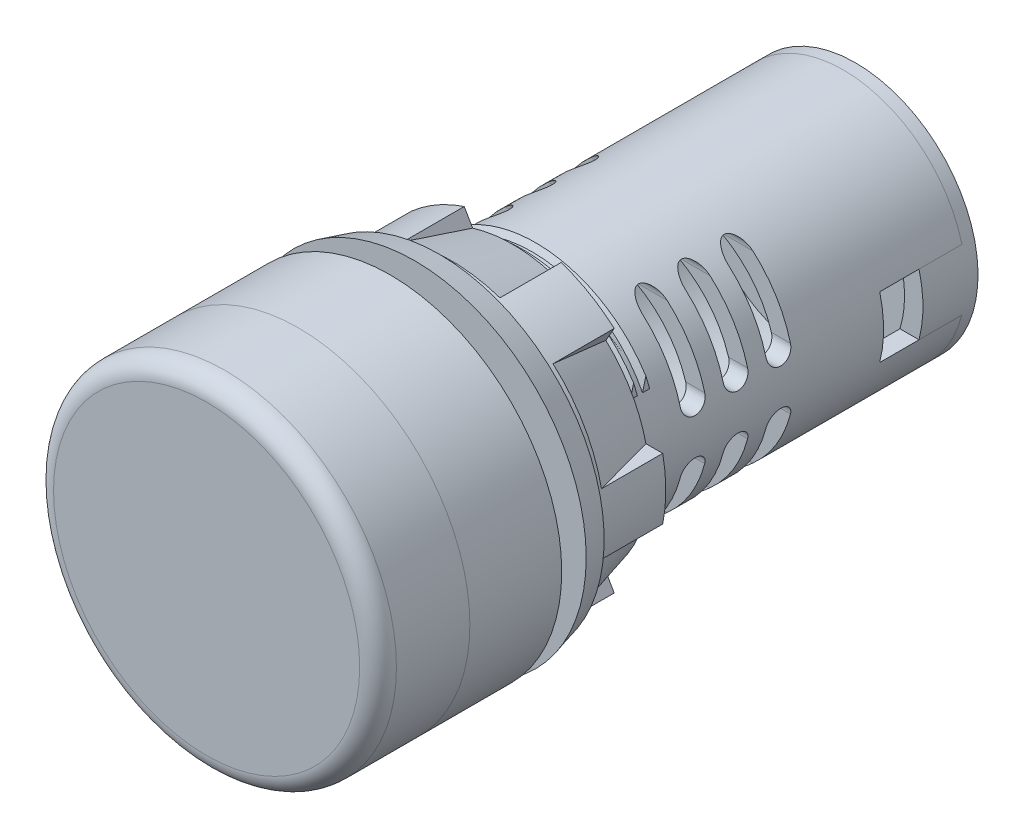
from build123d import *
from build123d.topology import SkipClean

# Parameters (mm, degrees)
VACIADO1_T                 = -1.5
CORTAR_EXTRUIR1_DEPTH      = 49.70574914730293
CORTAR_EXTRUIR1_DEPTH_BACK = 49.70574914730293
CROQUIS14_R                = 10.000000000000005
CROQUIS14_R_2              = 2.4999999999999947
CROQUIS14_R_3              = 2.499999999999994
SALIENTE_EXTRUIR3_DEPTH    = 1
SALIENTE_EXTRUIR4_DEPTH    = 3.5
SALIENTE_EXTRUIR1_START    = 2.5
SALIENTE_EXTRUIR1_DEPTH    = 2.5
BARRER1_PITCH              = 0.9999999999999974
CORTAR_EXTRUIR3_DEPTH      = 43.848570636603505
CROQUIS11_R                = 14.000000000000005
SALIENTE_EXTRUIR2_DEPTH    = 7.5
VACIADO5_T                 = -1.5
REDONDEO1_R                = 1.5
CROQUIS15_R                = 14.000000000000007
CROQUIS15_R_2              = 10.000000000000007
SALIENTE_EXTRUIR6_DEPTH    = 2
SALIENTE_EXTRUIR7_START    = 6
CROQUIS16_R                = 12.500000000000009
CROQUIS16_R_2              = 10.000000000000007
SALIENTE_EXTRUIR7_DEPTH    = 6
CHAFL_N1_SIZE              = 2
CHAFL_N1_SIZE_2            = 0.535898385
CHAFL_N2_SIZE              = 5
CHAFL_N2_SIZE2             = 1.339745962155617
SALIENTE_EXTRUIR9_START    = 6
SALIENTE_EXTRUIR9_DEPTH    = 6


with BuildPart() as part:
    # Croquis1 → Revolución1 (revolve)
    with BuildSketch(Plane(origin=(0, 0, 0), x_dir=(0, 0, -1), z_dir=(1, 0, 0))):
        Polygon((7.499999999999993, 9.999999999999998), (44.49999999999999, 9.999999999999998), (44.49999999999999, -2.56e-15), (7.499999999999995, -5.2e-15), (0, 0), (-6.94e-15, 14), (7.499999999999993, 14), align=None)
    revolve(axis=Axis((0, -2.56e-15, -44.49999999999999), (0, -7e-17, 1)))

    # Vaciado1
    vaciado1_openings = [part.faces().sort_by_distance(p)[0] for p in [
        (0, 0, 0),
    ]]
    offset(amount=VACIADO1_T, openings=vaciado1_openings, kind=Kind.INTERSECTION)

    # Croquis2 → Cortar-Extruir1 (cut, two sides: drawn at the far end of the back side and taken through both)
    with BuildSketch(Plane(origin=(0, 0, 0), x_dir=(0, 0, -1), z_dir=(1, 0, 0)).offset(-CORTAR_EXTRUIR1_DEPTH_BACK)):
        with BuildLine():
            Line((26.999999999999986, 7.499999999999998), (26.999999999999986, 2.499999999999998))
            ThreePointArc((26.999999999999986, 2.499999999999998), (25.999999999999993, 1.5000000000000013), (24.999999999999996, 2.4999999999999973))
            Line((24.999999999999996, 2.4999999999999973), (24.999999999999996, 7.499999999999998))
            ThreePointArc((24.999999999999996, 7.499999999999998), (25.999999999999993, 8.49999999999999), (26.999999999999986, 7.499999999999998))
        make_face()
        with BuildLine():
            Line((30.499999999999986, 7.499999999999998), (30.499999999999986, 2.499999999999998))
            ThreePointArc((30.499999999999986, 2.499999999999998), (29.499999999999993, 1.5000000000000013), (28.499999999999996, 2.4999999999999973))
            Line((28.499999999999996, 2.4999999999999973), (28.499999999999996, 7.499999999999998))
            ThreePointArc((28.499999999999996, 7.499999999999998), (29.499999999999993, 8.49999999999999), (30.499999999999986, 7.499999999999998))
        make_face()
        with BuildLine():
            Line((30.50000000000009, -2.500000000000002), (30.50000000000009, -7.500000000000003))
            ThreePointArc((30.50000000000009, -7.500000000000003), (29.500000000000096, -8.499999999999996), (28.500000000000103, -7.5000000000000036))
            Line((28.500000000000103, -7.5000000000000036), (28.500000000000103, -2.500000000000002))
            ThreePointArc((28.500000000000103, -2.500000000000002), (29.500000000000096, -1.5000000000000102), (30.50000000000009, -2.500000000000002))
        make_face()
        Polygon((44.5, 2.499999999999998), (37.787323049539765, 2.499999999999997), (37.787323049539765, -2.500000000000002), (44.49999999999999, -2.500000000000002), align=None)
        with BuildLine():
            Line((23.499999999999986, 7.499999999999973), (23.499999999999986, 2.499999999999974))
            ThreePointArc((23.499999999999986, 2.499999999999974), (22.499999999999993, 1.499999999999981), (21.5, 2.4999999999999734))
            Line((21.5, 2.4999999999999734), (21.5, 7.499999999999973))
            ThreePointArc((21.5, 7.499999999999973), (22.499999999999993, 8.499999999999964), (23.499999999999986, 7.499999999999973))
        make_face()
        with BuildLine():
            Line((23.50000000000009, -2.5000000000000266), (23.50000000000009, -7.500000000000027))
            ThreePointArc((23.50000000000009, -7.500000000000027), (22.500000000000096, -8.50000000000002), (21.500000000000103, -7.5000000000000275))
            Line((21.500000000000103, -7.5000000000000275), (21.500000000000103, -2.5000000000000266))
            ThreePointArc((21.500000000000103, -2.5000000000000266), (22.500000000000096, -1.5000000000000346), (23.50000000000009, -2.5000000000000266))
        make_face()
        with BuildLine():
            Line((27.00000000000009, -2.500000000000002), (27.00000000000009, -7.500000000000003))
            ThreePointArc((27.00000000000009, -7.500000000000003), (26.000000000000096, -8.499999999999996), (25.000000000000103, -7.5000000000000036))
            Line((25.000000000000103, -7.5000000000000036), (25.000000000000103, -2.500000000000002))
            ThreePointArc((25.000000000000103, -2.500000000000002), (26.000000000000096, -1.5000000000000102), (27.00000000000009, -2.500000000000002))
        make_face()
    extrude(amount=CORTAR_EXTRUIR1_DEPTH + CORTAR_EXTRUIR1_DEPTH_BACK, mode=Mode.SUBTRACT)

    # Croquis4 → Saliente-Extruir1 (add)
    with BuildSketch(Plane(origin=(0, 2.96e-15, -41.499999999999986), x_dir=(-1, 0, 0), z_dir=(0, 7e-17, -1)).offset(SALIENTE_EXTRUIR1_START)):
        with BuildLine():
            ThreePointArc((8.124038404635963, -2.5000000000000053), (8.500000000000002, -5.74e-15), (8.124038404635963, 2.4999999999999947))
            ThreePointArc((8.124038404635963, 2.4999999999999947), (5.2e-16, 8.499999999999996), (-8.124038404635963, 2.4999999999999947))
            ThreePointArc((-8.124038404635963, 2.4999999999999947), (-8.500000000000002, -4.7e-15), (-8.124038404635963, -2.500000000000005))
            ThreePointArc((-8.124038404635963, -2.500000000000005), (5.2e-16, -8.500000000000007), (8.124038404635963, -2.5000000000000053))
        make_face()
    extrude(amount=-SALIENTE_EXTRUIR1_DEPTH)

    # Barrer1: arcs per turn and ends read off the stored shape
    # Barrer1: the profile of Croquis9 profile screwed along a right-hand helix through 12 turns, 8 arcs to a turn; built about Z, then put on its axis
    barrer1_z = Axis((0, 0, 0), (0, 0, 1))
    barrer1_corners = [(9.9997, 0, -0.250173205), (10.5, 0, 0.038675135), (9.9997, 0, 0.327523474)]
    with BuildLine(mode=Mode.PRIVATE) as barrer1_profile:
        Line(barrer1_corners[0], barrer1_corners[1])
        Line(barrer1_corners[1], barrer1_corners[2])
        Line(barrer1_corners[2], barrer1_corners[0])
    barrer1_cap = Face(barrer1_profile.wire())
    barrer1_turn_angles = [0, 22.5, 45, 67.5, 90, 112.5, 135, 157.5, 180, 202.5, 225, 247.5, 270, 292.5, 315, 337.5, 360]
    barrer1_turn_weights = [1, 0.9238795325112867, 1, 0.9238795325112867, 1, 0.9238795325112867, 1, 0.9238795325112867, 1, 0.9238795325112867, 1, 0.9238795325112867, 1, 0.9238795325112867, 1, 0.9238795325112867, 1]
    barrer1_turn_rails = [Edge.make_bspline([Vector(p[0], p[1], 0).rotate(barrer1_z, barrer1_turn_angles[k]) / barrer1_turn_weights[k] + Vector(0, 0, p[2] + BARRER1_PITCH * barrer1_turn_angles[k] / 360) for k in range(17)], [0, 0, 0, 1, 1, 2, 2, 3, 3, 4, 4, 5, 5, 6, 6, 7, 7, 8, 8, 8], 2, barrer1_turn_weights) for p in barrer1_corners]
    barrer1_turn_sides = [Face.make_surface_from_curves(barrer1_turn_rails[p[0]], barrer1_turn_rails[p[1]]) for p in [(0, 1), (1, 2), (2, 0)]]
    barrer1 = Plane(origin=(0, -4.35e-15, -19.499999999999993), x_dir=(1, -3.49e-15, 0), z_dir=(0, -7e-17, 1)) * Solid(Shell([*[p.moved(Location((0, 0, BARRER1_PITCH * i))) for i in range(12) for p in barrer1_turn_sides], barrer1_cap, barrer1_cap.rotate(barrer1_z, 4320).moved(Location((0, 0, BARRER1_PITCH * 4320 / 360)))]))
    add(barrer1)

    # Croquis10 → Cortar-Extruir3 (cut, through all)
    with BuildSketch(Plane(origin=(0, 5.4e-16, -7.499999999999994), x_dir=(-1, 0, 0), z_dir=(0, 7e-17, -1))):
        with BuildLine():
            Line((-8.999999999999998, -6), (-8.999999999999998, -4.358898943540685))
            ThreePointArc((-8.999999999999998, -4.358898943540685), (-10, -4.52e-15), (-8.999999999999998, 4.358898943540672))
            Line((-8.999999999999998, 4.358898943540672), (-8.999999999999998, 6))
            Line((-8.999999999999998, 6), (-10.999999999999998, 6))
            Line((-10.999999999999998, 6), (-10.999999999999998, -6))
            Line((-10.999999999999998, -6), (-8.999999999999998, -6))
        make_face()
        with BuildLine():
            Line((8.999999999999998, 6), (10.999999999999998, 6))
            Line((10.999999999999998, 6), (10.999999999999998, -6))
            Line((10.999999999999998, -6), (8.999999999999998, -6))
            Line((8.999999999999998, -6), (8.999999999999998, -4.358898943540685))
            ThreePointArc((8.999999999999998, -4.358898943540685), (10, -6.29e-15), (8.999999999999998, 4.358898943540672))
            Line((8.999999999999998, 4.358898943540672), (8.999999999999998, 6))
        make_face()
    extrude(amount=CORTAR_EXTRUIR3_DEPTH, mode=Mode.SUBTRACT)


with BuildPart() as body_2:
    # Croquis14 → Saliente-Extruir3 (new body)
    # profile 1 of 3: a face of its own
    with BuildSketch(Plane(origin=(0, 3.18e-15, -44.49999999999999), x_dir=(-1, 0, 0), z_dir=(0, 7e-17, -1))):
        Circle(CROQUIS14_R)
        with Locations((-5, 5.2e-16)):
            Circle(CROQUIS14_R_2, mode=Mode.SUBTRACT)
        with Locations((5, 2.3e-16)):
            Circle(CROQUIS14_R_3, mode=Mode.SUBTRACT)
    # profile 2 of 3: a face of its own
    with BuildSketch(Plane(origin=(0, 3.18e-15, -44.49999999999999), x_dir=(-1, 0, 0), z_dir=(0, 7e-17, -1))):
        with BuildLine():
            Line((9.682458365518544, 2.4999999999999942), (8.124038404635963, 2.4999999999999942))
            ThreePointArc((8.124038404635963, 2.4999999999999942), (8.500000000000002, -5.27e-15), (8.124038404635963, -2.500000000000005))
            Line((8.124038404635963, -2.500000000000005), (9.682458365518546, -2.500000000000005))
            ThreePointArc((9.682458365518546, -2.500000000000005), (10.000000000000004, -5.18e-15), (9.682458365518544, 2.4999999999999942))
        make_face()
    # profile 3 of 3: a face of its own
    with BuildSketch(Plane(origin=(0, 3.18e-15, -44.49999999999999), x_dir=(-1, 0, 0), z_dir=(0, 7e-17, -1))):
        with BuildLine():
            Line((-9.682458365518546, -2.500000000000005), (-8.124038404635963, -2.500000000000005))
            ThreePointArc((-8.124038404635963, -2.500000000000005), (-8.500000000000004, -4.7e-15), (-8.124038404635964, 2.4999999999999942))
            Line((-8.124038404635964, 2.4999999999999942), (-9.682458365518544, 2.4999999999999942))
            ThreePointArc((-9.682458365518544, 2.4999999999999942), (-10.000000000000002, -4.52e-15), (-9.682458365518546, -2.500000000000005))
        make_face()
    extrude(amount=SALIENTE_EXTRUIR3_DEPTH)

    # Croquis14<4> → Saliente-Extruir4 (add)
    with SkipClean():  # the faces are left unmerged after this step: merging them gives an invalid solid
        with BuildSketch(Plane(origin=(0, 3.18e-15, -44.49999999999999), x_dir=(-1, 0, 0), z_dir=(0, 7e-17, -1))):
            with BuildLine():
                Line((-8.124038404635964, 2.4999999999999942), (-9.682458365518544, 2.4999999999999942))
                ThreePointArc((-9.682458365518547, 2.4999999999999982), (-10.000000000000005, -4.52e-15), (-9.68245836551855, -2.500000000000003))
                Line((-9.682458365518546, -2.500000000000005), (-8.124038404635963, -2.500000000000005))
                ThreePointArc((-8.124038404635964, -2.500000000000006), (-8.500000000000004, -6e-15), (-8.124038404635964, 2.499999999999994))
            make_face()
            with BuildLine():
                ThreePointArc((10.000000000000005, -5.74e-15), (9.920296962671673, 1.260042924827276), (9.682458365518547, 2.4999999999999956))
                Line((9.682458365518544, 2.4999999999999942), (8.124038404635963, 2.4999999999999942))
                ThreePointArc((8.124038404635964, 2.4999999999999947), (8.500000000000004, -5.66e-15), (8.124038404635964, -2.5000000000000053))
                Line((8.124038404635963, -2.500000000000005), (9.682458365518546, -2.500000000000005))
                ThreePointArc((9.682458365518547, -2.500000000000011), (9.920296962671673, -1.2600429248272864), (10.000000000000005, -8.19e-15))
            make_face()
        extrude(amount=-SALIENTE_EXTRUIR4_DEPTH)


with BuildPart() as body_3:
    # Croquis11 → Saliente-Extruir2 (new body)
    with BuildSketch(Plane.XY):
        Circle(CROQUIS11_R)
    extrude(amount=SALIENTE_EXTRUIR2_DEPTH)

    # Vaciado5
    vaciado5_openings = [body_3.faces().sort_by_distance(p)[0] for p in [
        (0, 0, 0),
    ]]
    offset(amount=VACIADO5_T, openings=vaciado5_openings, kind=Kind.INTERSECTION)

    # Redondeo1
    redondeo1_edges = [body_3.edges().sort_by_distance(p)[0] for p in [
        (-14.000000000000005, -4.03e-15, 7.5),
    ]]
    fillet(redondeo1_edges, radius=REDONDEO1_R)


with BuildPart() as body_4:
    # Croquis15 → Saliente-Extruir6 (new body)
    with BuildSketch(Plane(origin=(0, 6.8e-16, -9.499999999999993), x_dir=(-1, 0, 0), z_dir=(0, 7e-17, -1))):
        with Locations(Location((0, -5.74e-15, 0), (0, 0, 90))):
            Circle(CROQUIS15_R)
        with Locations(Location((0, -5.74e-15, 0), (0, 0, 90))):
            Circle(CROQUIS15_R_2, mode=Mode.SUBTRACT)
    extrude(amount=SALIENTE_EXTRUIR6_DEPTH)

    # Croquis16 → Saliente-Extruir7 (add)
    with BuildSketch(Plane(origin=(0, 8.2e-16, -11.499999999999993), x_dir=(-1, 0, 0), z_dir=(0, 7e-17, -1)).offset(SALIENTE_EXTRUIR7_START)):
        with Locations(Location((0, -5.74e-15, 0), (0, 0, 90))):
            Circle(CROQUIS16_R)
        with Locations(Location((0, -5.74e-15, 0), (0, 0, 90))):
            Circle(CROQUIS16_R_2, mode=Mode.SUBTRACT)
    extrude(amount=-SALIENTE_EXTRUIR7_DEPTH)

    # Chaflán1
    # the kernel refuses this chamfer: 2, 0.535898385 mm, written as the material it takes off along each edge
    with BuildSketch(Plane(origin=(0, -4.92e-15, -11.499999999999993), x_dir=(-6e-17, 1, 1.3e-16), z_dir=(-1, -6e-17, 0))) as chafl_n1_piece_1:
        Polygon((14.000000000000007, -CHAFL_N1_SIZE), (14.000000000000007 - CHAFL_N1_SIZE_2, 1.71e-15), (14.000000000000007, 1.78e-15), align=None)
    revolve(axis=Axis((0, -4.92e-15, -11.499999999999993), (0, 7e-17, -1)), mode=Mode.SUBTRACT)

    # Chaflán2
    chafl_n2_edges = [body_4.edges().sort_by_distance(p)[0] for p in [
        (2.3e-15, -12.500000000000012, -17.499999999999993),
    ]]
    chafl_n2_side = [body_4.faces().sort_by_distance(p)[0] for p in [
        (2.3e-15, -12.500000000000014, -14.499999999999993),
    ]]
    chamfer(chafl_n2_edges, length=CHAFL_N2_SIZE, length2=CHAFL_N2_SIZE2, reference=chafl_n2_side[0])

    # Croquis20 → Saliente-Extruir9 (add)
    with BuildSketch(Plane(origin=(0, 8.2e-16, -11.499999999999993), x_dir=(-1, 0, 0), z_dir=(0, 7e-17, -1)).offset(SALIENTE_EXTRUIR9_START)):
        with BuildLine():
            Line((-3.958660847496834, 11.85660171779823), (-3.2732558584415785, 10.66944545299333))
            ThreePointArc((-3.2732558584415785, 10.66944545299333), (-5.580127018922186, 9.665063509461113), (-7.603382877363777, 8.169445452993338))
            Line((-7.603382877363777, 8.169445452993338), (-8.28878786641903, 9.356601717798236))
            ThreePointArc((-8.28878786641903, 9.356601717798236), (-6.249999999999987, 10.825317547305504), (-3.958660847496834, 11.85660171779823))
        make_face()
        with BuildLine():
            Line((-12.247448713915897, -2.5000000000000058), (-10.876638735805383, -2.5000000000000067))
            ThreePointArc((-10.876638735805383, -2.5000000000000067), (-11.160254037844396, -4.37e-15), (-10.876638735805384, 2.4999999999999933))
            Line((-10.876638735805384, 2.4999999999999933), (-12.247448713915901, 2.4999999999999933))
            ThreePointArc((-12.247448713915901, 2.4999999999999933), (-12.50000000000001, -4.21e-15), (-12.247448713915897, -2.5000000000000058))
        make_face()
        with BuildLine():
            Line((8.288787866419085, 9.35660171779819), (7.6033828773638215, 8.169445452993294))
            ThreePointArc((7.6033828773638215, 8.169445452993294), (5.580127018922237, 9.665063509461081), (3.2732558584416385, 10.669445452993312))
            Line((3.2732558584416385, 10.669445452993312), (3.9586608474969025, 11.856601717798206))
            ThreePointArc((3.9586608474969025, 11.856601717798206), (6.25000000000005, 10.825317547305467), (8.288787866419085, 9.35660171779819))
        make_face()
        with BuildLine():
            Line((12.247448713915883, -2.500000000000078), (10.876638735805367, -2.5000000000000684))
            ThreePointArc((10.876638735805367, -2.5000000000000684), (11.160254037844393, -7.048e-14), (10.8766387358054, 2.4999999999999316))
            Line((10.8766387358054, 2.4999999999999316), (12.247448713915915, 2.499999999999921))
            ThreePointArc((12.247448713915915, 2.499999999999921), (12.500000000000007, -8.033e-14), (12.247448713915883, -2.500000000000078))
        make_face()
        with BuildLine():
            Line((3.9586608474967493, -11.856601717798256), (3.273255858441502, -10.669445452993351))
            ThreePointArc((3.273255858441502, -10.669445452993351), (5.580127018922112, -9.665063509461152), (7.6033828773637175, -8.16944545299339))
            Line((7.6033828773637175, -8.16944545299339), (8.288787866418962, -9.356601717798293))
            ThreePointArc((8.288787866418962, -9.356601717798293), (6.249999999999909, -10.825317547305545), (3.9586608474967493, -11.856601717798256))
        make_face()
        with BuildLine():
            Line((-8.288787866419153, -9.356601717798128), (-7.603382877363881, -8.169445452993237))
            ThreePointArc((-7.603382877363881, -8.169445452993237), (-5.580127018922305, -9.665063509461042), (-3.2732558584417157, -10.669445452993287))
            Line((-3.2732558584417157, -10.669445452993287), (-3.9586608474969878, -11.856601717798174))
            ThreePointArc((-3.9586608474969878, -11.856601717798174), (-6.250000000000131, -10.825317547305419), (-8.288787866419153, -9.356601717798128))
        make_face()
    extrude(amount=-SALIENTE_EXTRUIR9_DEPTH)


solid = Compound([part.part, body_2.part, body_3.part, body_4.part])
